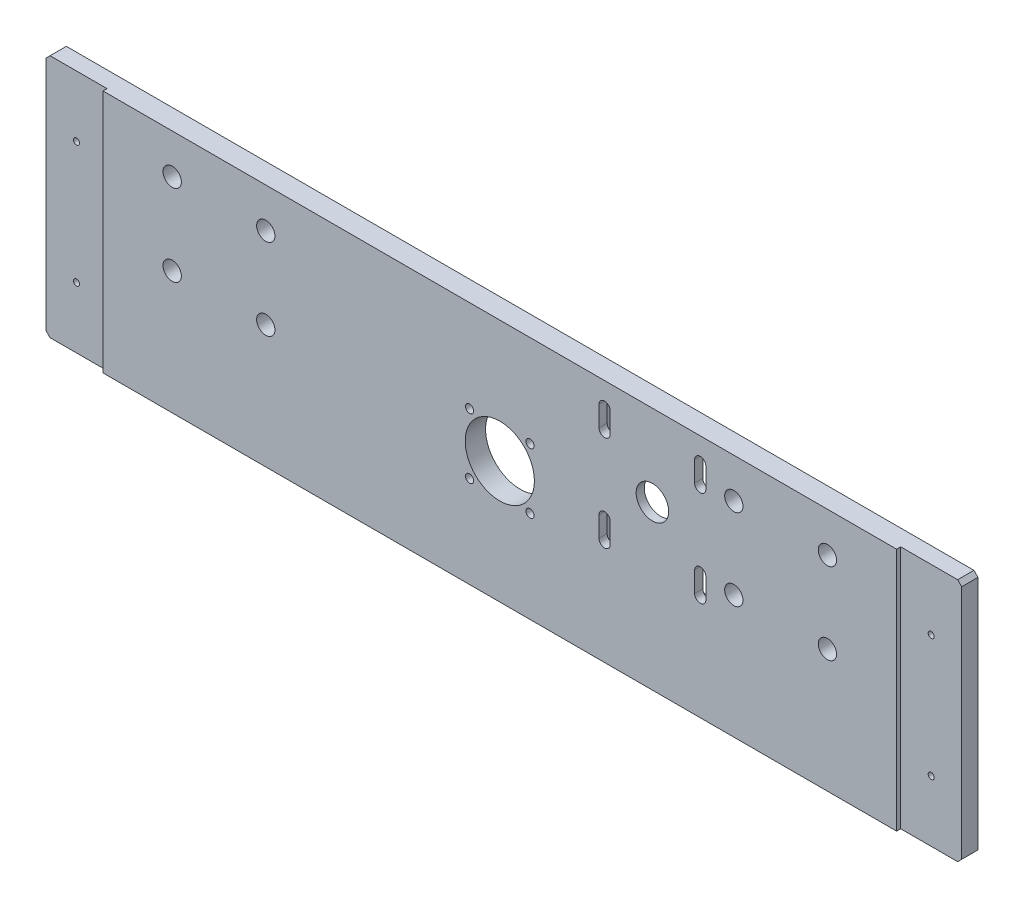
from build123d import *

# Parameters (mm, degrees)
SCHIZZO1_R                   = 17
SCHIZZO1_R_2                 = 2
SCHIZZO1_R_3                 = 4.5
SCHIZZO1_R_4                 = 1.5
SCHIZZO1_R_5                 = 8
ESTRUSIONE_ESTRUSIONE1_DEPTH = 10
SCHIZZO2_W                   = 30
SCHIZZO2_H                   = 120
TAGLIO_ESTRUSIONE1_DEPTH     = 2
SCHIZZO3_W                   = 60
SCHIZZO3_H                   = 72
TAGLIO_ESTRUSIONE2_DEPTH     = 6


with BuildPart() as part:
    # Schizzo1 → Estrusione-Estrusione1 (new body)
    with BuildSketch(Plane.XY):
        Polygon((2, 0), (448, 0), (450, 2), (450, 118), (448, 120), (2, 120), (0, 118), (0, 2), align=None)
        with Locations((225, 60)):
            Circle(SCHIZZO1_R, mode=Mode.SUBTRACT)
        with Locations((239.849242405, 74.849242405)):
            Circle(SCHIZZO1_R_2, mode=Mode.SUBTRACT)
        with Locations((386, 100.5)):
            Circle(SCHIZZO1_R_3, mode=Mode.SUBTRACT)
        with Locations((239.849242405, 45.150757595)):
            Circle(SCHIZZO1_R_2, mode=Mode.SUBTRACT)
        with Locations((210.150757595, 45.150757595)):
            Circle(SCHIZZO1_R_2, mode=Mode.SUBTRACT)
        with Locations((110, 100.5)):
            Circle(SCHIZZO1_R_3, mode=Mode.SUBTRACT)
        with Locations((110, 60.5)):
            Circle(SCHIZZO1_R_3, mode=Mode.SUBTRACT)
        with Locations((64, 60.5)):
            Circle(SCHIZZO1_R_3, mode=Mode.SUBTRACT)
        with Locations((64, 100.5)):
            Circle(SCHIZZO1_R_3, mode=Mode.SUBTRACT)
        with Locations((386, 60.5)):
            Circle(SCHIZZO1_R_3, mode=Mode.SUBTRACT)
        with Locations((15, 30)):
            Circle(SCHIZZO1_R_4, mode=Mode.SUBTRACT)
        with Locations((435, 30)):
            Circle(SCHIZZO1_R_4, mode=Mode.SUBTRACT)
        with Locations((210.150757595, 74.849242405)):
            Circle(SCHIZZO1_R_2, mode=Mode.SUBTRACT)
        with Locations((340, 60.5)):
            Circle(SCHIZZO1_R_3, mode=Mode.SUBTRACT)
        with Locations((340, 100.5)):
            Circle(SCHIZZO1_R_3, mode=Mode.SUBTRACT)
        with Locations((435, 90)):
            Circle(SCHIZZO1_R_4, mode=Mode.SUBTRACT)
        with Locations((15, 90)):
            Circle(SCHIZZO1_R_4, mode=Mode.SUBTRACT)
        with Locations((300, 80)):
            Circle(SCHIZZO1_R_5, mode=Mode.SUBTRACT)
        with BuildLine():
            Line((320.75, 108.5), (320.75, 98.5))
            ThreePointArc((320.75, 98.5), (323.5, 95.75), (326.25, 98.5))
            Line((326.25, 98.5), (326.25, 108.5))
            ThreePointArc((326.25, 108.5), (323.5, 111.25), (320.75, 108.5))
        make_face(mode=Mode.SUBTRACT)
        with BuildLine():
            Line((279.25, 108.5), (279.25, 98.5))
            ThreePointArc((279.25, 98.5), (276.5, 95.75), (273.75, 98.5))
            Line((273.75, 98.5), (273.75, 108.5))
            ThreePointArc((273.75, 108.5), (276.5, 111.25), (279.25, 108.5))
        make_face(mode=Mode.SUBTRACT)
        with BuildLine():
            Line((320.75, 51.5), (320.75, 61.5))
            ThreePointArc((320.75, 61.5), (323.5, 64.25), (326.25, 61.5))
            Line((326.25, 61.5), (326.25, 51.5))
            ThreePointArc((326.25, 51.5), (323.5, 48.75), (320.75, 51.5))
        make_face(mode=Mode.SUBTRACT)
        with BuildLine():
            Line((279.25, 51.5), (279.25, 61.5))
            ThreePointArc((279.25, 61.5), (276.5, 64.25), (273.75, 61.5))
            Line((273.75, 61.5), (273.75, 51.5))
            ThreePointArc((273.75, 51.5), (276.5, 48.75), (279.25, 51.5))
        make_face(mode=Mode.SUBTRACT)
    extrude(amount=-ESTRUSIONE_ESTRUSIONE1_DEPTH)

    # Schizzo2 → Taglio-Estrusione1 (cut)
    with BuildSketch(Plane.XY):
        with Locations((15, 60)):
            Rectangle(SCHIZZO2_W, SCHIZZO2_H)
        with Locations((615.438855383, 60)):
            Rectangle(SCHIZZO2_W, SCHIZZO2_H)
        with Locations((435, 60)):
            Rectangle(SCHIZZO2_W, SCHIZZO2_H)
    extrude(amount=-TAGLIO_ESTRUSIONE1_DEPTH, mode=Mode.SUBTRACT)

    # Schizzo3 → Taglio-Estrusione2 (cut)
    with BuildSketch(Plane(origin=(0, 0, -10), x_dir=(-1, 0, 0), z_dir=(0, 0, -1))):
        with Locations((-300, 80)):
            Rectangle(SCHIZZO3_W, SCHIZZO3_H)
    extrude(amount=-TAGLIO_ESTRUSIONE2_DEPTH, mode=Mode.SUBTRACT)


solid = part.part
